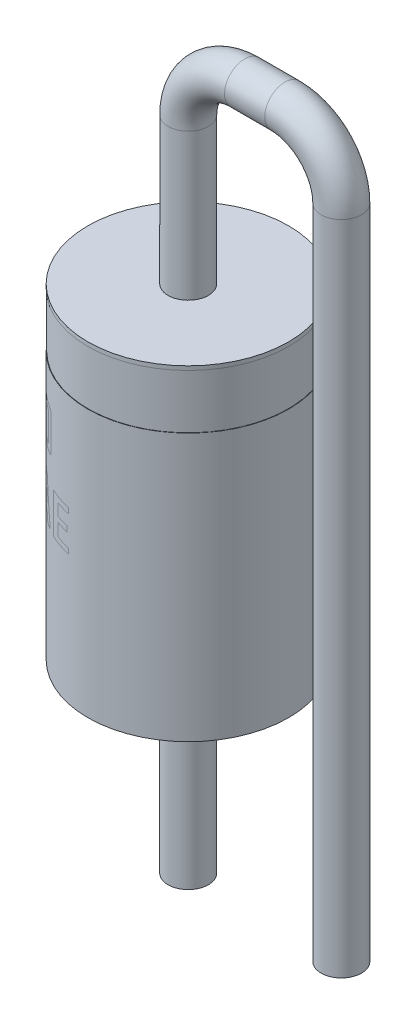
from build123d import *

# Parameters (mm, degrees)
SKETCH1_R     = 2.5
BODY_DEPTH    = 4.05
CATHODE_START = 0.1
SKETCH8_R     = 2.51
SKETCH8_R_2   = 2.49
CATHODE_DEPTH = 1.35
SKETCH6_R     = 0.50175


with BuildPart() as part:
    # Sketch1 → BODY (new, symmetric)
    with BuildSketch(Plane(origin=(0, 6.05, 0), x_dir=(1, 0, 0), z_dir=(0, 1, 0))):
        Circle(SKETCH1_R)
    extrude(amount=BODY_DEPTH, both=True)

    # Sketch8 → CATHODE (cut)
    with BuildSketch(Plane(origin=(0, 10.1, 0), x_dir=(0, 0, 1), z_dir=(0, -1, 0)).offset(CATHODE_START)):
        Circle(SKETCH8_R)
        Circle(SKETCH8_R_2, mode=Mode.SUBTRACT)
    extrude(amount=CATHODE_DEPTH, mode=Mode.SUBTRACT)

    # PINS: sweep along a path in Sketch7
    with BuildLine(Plane.XY) as pins_path:
        Line((0, -2.6), (0, 13.74308824))
        ThreePointArc((0, 13.74308824), (0.411485683, 14.736502557), (1.4049, 15.14798824))
        Line((1.4049, 15.14798824), (2.4051, 15.14798824))
        ThreePointArc((2.4051, 15.14798824), (3.398514317, 14.736502557), (3.81, 13.74308824))
        Line((3.81, 13.74308824), (3.81, -2.6))
    # Sketch6 → PINS (sweep)
    with BuildSketch(Plane(origin=(0, 6.05, 0), x_dir=(1, 0, 0), z_dir=(0, 1, 0))):
        Circle(SKETCH6_R)
    sweep(path=pins_path.line)


solid = part.part
